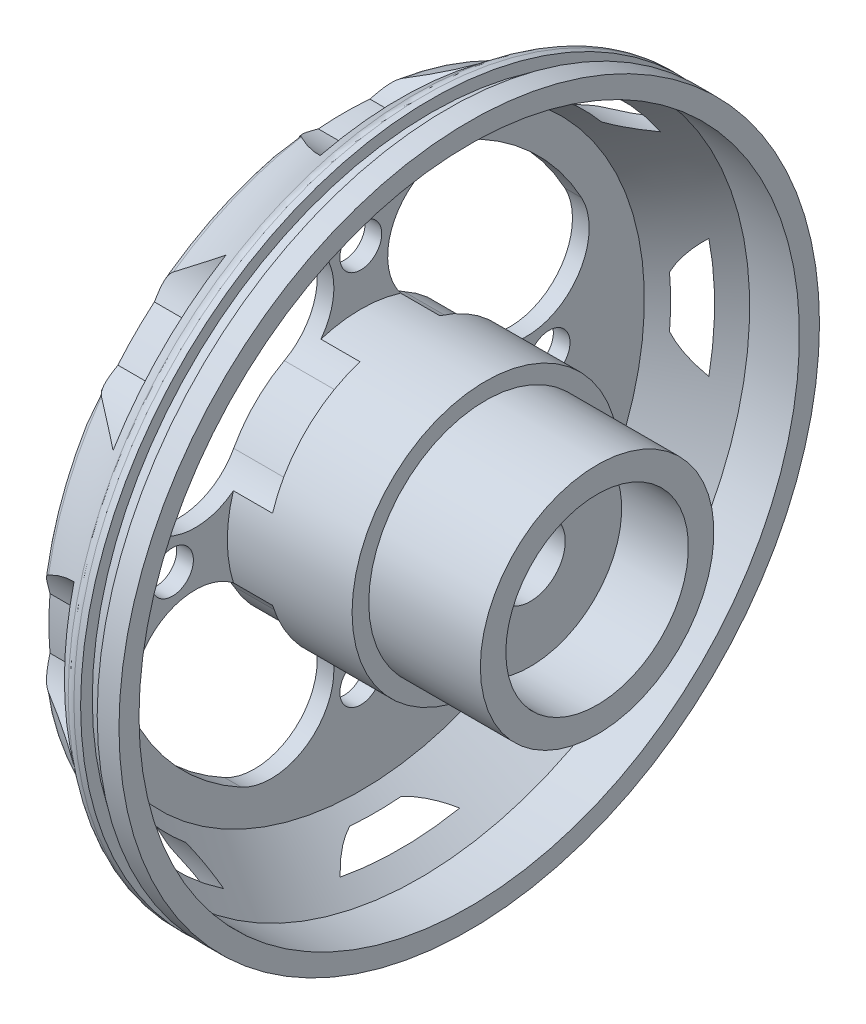
from build123d import *

# Parameters (mm, degrees)
FILLET1_R          = 1
CUT_EXTRUDE2_START = -4
CUT_EXTRUDE2_DEPTH = 4
SKETCH3_R          = 1.5
CUT_EXTRUDE3_DEPTH = 4


with BuildPart() as part:
    # Sketch1 → Revolve1 (revolve)
    with BuildSketch(Plane.XY):
        with BuildLine():
            Line((13.355, 6.545), (13.355, 2.5))
            Line((13.355, 2.5), (4.784, 2.5))
            Line((4.784, 2.5), (4.784, 6.545))
            Line((4.784, 6.545), (0, 6.545))
            Line((0, 6.545), (0, 21.81504))
            ThreePointArc((0, 21.81504), (2.810772962, 23.266882396), (5.382, 25.11))
            Line((5.382, 25.11), (6.2192, 25.11))
            Line((6.2192, 25.11), (6.2192, 24.2728))
            Line((6.2192, 24.2728), (7.4092, 24.2728))
            Line((7.4092, 24.2728), (7.4092, 25.11))
            Line((7.4092, 25.11), (8.97, 25.11))
            Line((8.97, 25.11), (8.97, 23.6748))
            Line((8.97, 23.6748), (5.4, 23.6748))
            Line((5.4, 23.6748), (1.196, 20.332))
            Line((1.196, 20.332), (1.196, 9.568))
            Line((1.196, 9.568), (10.139, 9.568))
            Line((10.139, 9.568), (10.139, 8.372))
            Line((10.139, 8.372), (18.139, 8.372))
            Line((18.139, 8.372), (18.139, 6.545))
            Line((18.139, 6.545), (13.355, 6.545))
        make_face()
    revolve(axis=Axis((0, 0, 0), (1, 0, 0)))

    # Fillet1
    fillet1_edges = [part.edges().sort_by_distance(p)[0] for p in [
        (5.382, -25.11, 0),
        (0, -21.81504, 0),
    ]]
    fillet(fillet1_edges, radius=FILLET1_R)

    # Sketch2 → Cut-Extrude2 (cut)
    with BuildSketch(Plane.ZY.offset(CUT_EXTRUDE2_START)):
        with BuildLine():
            ThreePointArc((7.914588635, 4.284773825), (14.014269866, 2.46986642), (15.829177271, 8.56954765))
            ThreePointArc((15.829177271, 8.56954765), (12.727922061, 12.727922061), (8.56954765, 15.829177271))
            ThreePointArc((8.56954765, 15.829177271), (2.46986642, 14.014269866), (4.284773825, 7.914588635))
            ThreePointArc((4.284773825, 7.914588635), (6.363961031, 6.363961031), (7.914588635, 4.284773825))
        make_face()
        with BuildLine():
            ThreePointArc((4.284773825, -7.914588635), (2.46986642, -14.014269866), (8.56954765, -15.829177271))
            ThreePointArc((8.56954765, -15.829177271), (12.727922061, -12.727922061), (15.829177271, -8.56954765))
            ThreePointArc((15.829177271, -8.56954765), (14.014269866, -2.46986642), (7.914588635, -4.284773825))
            ThreePointArc((7.914588635, -4.284773825), (6.363961031, -6.363961031), (4.284773825, -7.914588635))
        make_face()
        with BuildLine():
            ThreePointArc((-7.914588635, -4.284773825), (-14.014269866, -2.46986642), (-15.829177271, -8.56954765))
            ThreePointArc((-15.829177271, -8.56954765), (-12.727922061, -12.727922061), (-8.56954765, -15.829177271))
            ThreePointArc((-8.56954765, -15.829177271), (-2.46986642, -14.014269866), (-4.284773825, -7.914588635))
            ThreePointArc((-4.284773825, -7.914588635), (-6.363961031, -6.363961031), (-7.914588635, -4.284773825))
        make_face()
        with BuildLine():
            ThreePointArc((-4.284773825, 7.914588635), (-2.46986642, 14.014269866), (-8.56954765, 15.829177271))
            ThreePointArc((-8.56954765, 15.829177271), (-12.727922061, 12.727922061), (-15.829177271, 8.56954765))
            ThreePointArc((-15.829177271, 8.56954765), (-14.014269866, 2.46986642), (-7.914588635, 4.284773825))
            ThreePointArc((-7.914588635, 4.284773825), (-6.363961031, 6.363961031), (-4.284773825, 7.914588635))
        make_face()
        with BuildLine():
            ThreePointArc((21.715567603, 12.607387663), (17.755451276, 17.755451276), (12.607387663, 21.715567603))
            ThreePointArc((12.607387663, 21.715567603), (12.594280438, 18.874157313), (13.601152135, 16.217092463))
            ThreePointArc((13.601152135, 16.217092463), (14.966386126, 14.966386126), (16.217092463, 13.601152135))
            ThreePointArc((16.217092463, 13.601152135), (18.874157313, 12.594280438), (21.715567603, 12.607387663))
        make_face()
        with BuildLine():
            ThreePointArc((1.849749145, 21.084682958), (4.440543523, 22.251545727), (6.4404558, 24.269994419))
            ThreePointArc((6.4404558, 24.269994419), (0, 25.11), (-6.4404558, 24.269994419))
            ThreePointArc((-6.4404558, 24.269994419), (-4.440543523, 22.251545727), (-1.849749145, 21.084682958))
            ThreePointArc((-1.849749145, 21.084682958), (0, 21.165666239), (1.849749145, 21.084682958))
        make_face()
        with BuildLine():
            ThreePointArc((24.269994419, -6.4404558), (25.11, 0), (24.269994419, 6.4404558))
            ThreePointArc((24.269994419, 6.4404558), (22.251545727, 4.440543523), (21.084682958, 1.849749145))
            ThreePointArc((21.084682958, 1.849749145), (21.165666239, 0), (21.084682958, -1.849749145))
            ThreePointArc((21.084682958, -1.849749145), (22.251545727, -4.440543523), (24.269994419, -6.4404558))
        make_face()
        with BuildLine():
            ThreePointArc((-13.601152135, 16.217092463), (-12.594280438, 18.874157313), (-12.607387663, 21.715567603))
            ThreePointArc((-12.607387663, 21.715567603), (-17.755451276, 17.755451276), (-21.715567603, 12.607387663))
            ThreePointArc((-21.715567603, 12.607387663), (-18.874157313, 12.594280438), (-16.217092463, 13.601152135))
            ThreePointArc((-16.217092463, 13.601152135), (-14.966386126, 14.966386126), (-13.601152135, 16.217092463))
        make_face()
        with BuildLine():
            ThreePointArc((21.715567603, -12.607387663), (18.874157313, -12.594280438), (16.217092463, -13.601152135))
            ThreePointArc((16.217092463, -13.601152135), (14.966386126, -14.966386126), (13.601152135, -16.217092463))
            ThreePointArc((13.601152135, -16.217092463), (12.594280438, -18.874157313), (12.607387663, -21.715567603))
            ThreePointArc((12.607387663, -21.715567603), (17.755451276, -17.755451276), (21.715567603, -12.607387663))
        make_face()
        with BuildLine():
            ThreePointArc((-21.084682958, 1.849749145), (-22.251545727, 4.440543523), (-24.269994419, 6.4404558))
            ThreePointArc((-24.269994419, 6.4404558), (-25.11, 0), (-24.269994419, -6.4404558))
            ThreePointArc((-24.269994419, -6.4404558), (-22.251545727, -4.440543523), (-21.084682958, -1.849749145))
            ThreePointArc((-21.084682958, -1.849749145), (-21.165666239, 0), (-21.084682958, 1.849749145))
        make_face()
        with BuildLine():
            ThreePointArc((6.4404558, -24.269994419), (4.440543523, -22.251545727), (1.849749145, -21.084682958))
            ThreePointArc((1.849749145, -21.084682958), (0, -21.165666239), (-1.849749145, -21.084682958))
            ThreePointArc((-1.849749145, -21.084682958), (-4.440543523, -22.251545727), (-6.4404558, -24.269994419))
            ThreePointArc((-6.4404558, -24.269994419), (0, -25.11), (6.4404558, -24.269994419))
        make_face()
        with BuildLine():
            ThreePointArc((-16.217092463, -13.601152135), (-18.874157313, -12.594280438), (-21.715567603, -12.607387663))
            ThreePointArc((-21.715567603, -12.607387663), (-17.755451276, -17.755451276), (-12.607387663, -21.715567603))
            ThreePointArc((-12.607387663, -21.715567603), (-12.594280438, -18.874157313), (-13.601152135, -16.217092463))
            ThreePointArc((-13.601152135, -16.217092463), (-14.966386126, -14.966386126), (-16.217092463, -13.601152135))
        make_face()
    extrude(amount=CUT_EXTRUDE2_DEPTH, mode=Mode.SUBTRACT)

    # Sketch3 → Cut-Extrude3 (cut)
    with BuildSketch(Plane.ZY):
        with Locations((0, 13.5)):
            Circle(SKETCH3_R)
        with Locations((13.5, 0)):
            Circle(SKETCH3_R)
        with Locations((0, -13.5)):
            Circle(SKETCH3_R)
        with Locations((-13.5, 0)):
            Circle(SKETCH3_R)
    extrude(amount=-CUT_EXTRUDE3_DEPTH, mode=Mode.SUBTRACT)


solid = part.part
